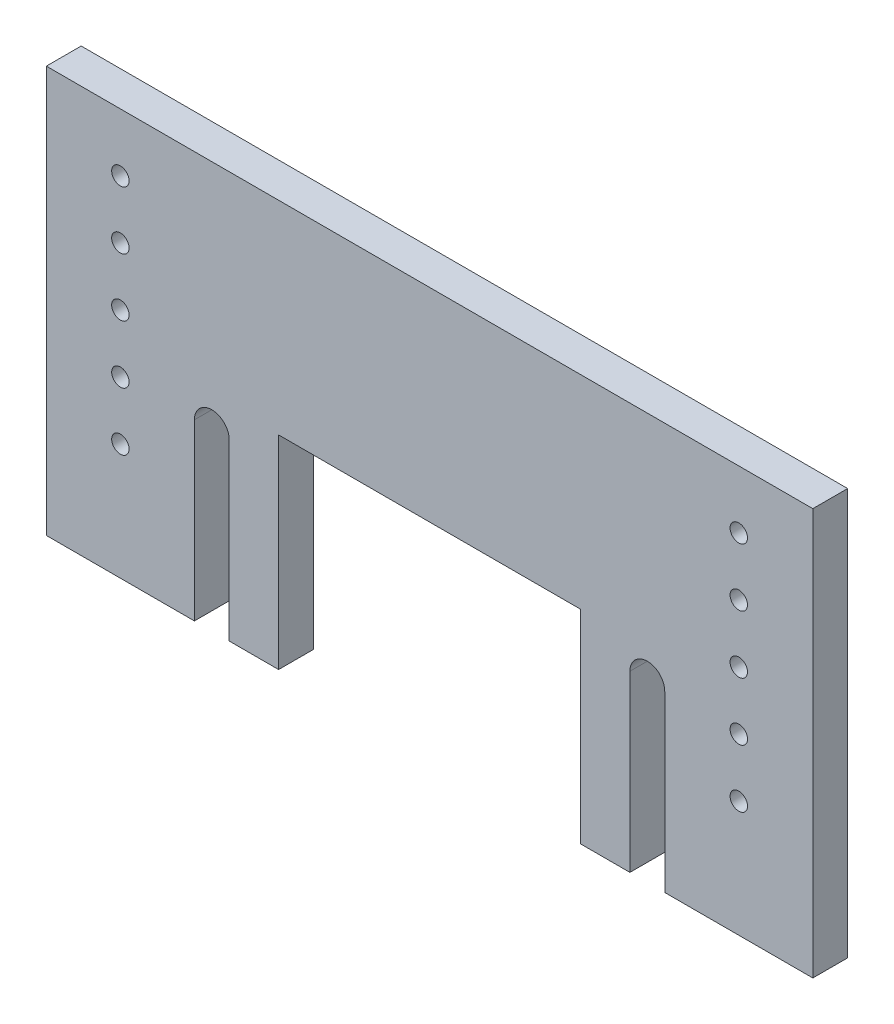
from build123d import *

# Parameters (mm, degrees)
ESBO_O1_R                = 1.5
RESSALTO_EXTRUS_O1_DEPTH = 6


with BuildPart() as part:
    # Esboço1 → Ressalto-extrusão1 (new body)
    with BuildSketch(Plane.XY):
        with BuildLine():
            Line((-66, -35), (-40.5, -35))
            Line((-40.5, -35), (-40.5, -5))
            ThreePointArc((-40.5, -5), (-37.5, -2), (-34.5, -5))
            Line((-34.5, -5), (-34.5, -35))
            Line((-34.5, -35), (-26, -35))
            Line((-26, -35), (-26, 0))
            Line((-26, 0), (26, 0))
            Line((26, 0), (26, -35))
            Line((26, -35), (34.5, -35))
            Line((34.5, -35), (34.5, -5))
            ThreePointArc((34.5, -5), (37.5, -2), (40.5, -5))
            Line((40.5, -5), (40.5, -35))
            Line((40.5, -35), (66, -35))
            Line((66, -35), (66, 35))
            Line((66, 35), (-66, 35))
            Line((-66, 35), (-66, -35))
        make_face()
        with Locations((-53.25, -5)):
            Circle(ESBO_O1_R, mode=Mode.SUBTRACT)
        with Locations((-53.25, -15)):
            Circle(ESBO_O1_R, mode=Mode.SUBTRACT)
        with Locations((-53.25, 15)):
            Circle(ESBO_O1_R, mode=Mode.SUBTRACT)
        with Locations((-53.25, 25)):
            Circle(ESBO_O1_R, mode=Mode.SUBTRACT)
        with Locations((-53.25, 5)):
            Circle(ESBO_O1_R, mode=Mode.SUBTRACT)
        with Locations((53.25, 5)):
            Circle(ESBO_O1_R, mode=Mode.SUBTRACT)
        with Locations((53.25, 25)):
            Circle(ESBO_O1_R, mode=Mode.SUBTRACT)
        with Locations((53.25, 15)):
            Circle(ESBO_O1_R, mode=Mode.SUBTRACT)
        with Locations((53.25, -15)):
            Circle(ESBO_O1_R, mode=Mode.SUBTRACT)
        with Locations((53.25, -5)):
            Circle(ESBO_O1_R, mode=Mode.SUBTRACT)
    extrude(amount=RESSALTO_EXTRUS_O1_DEPTH)


solid = part.part
